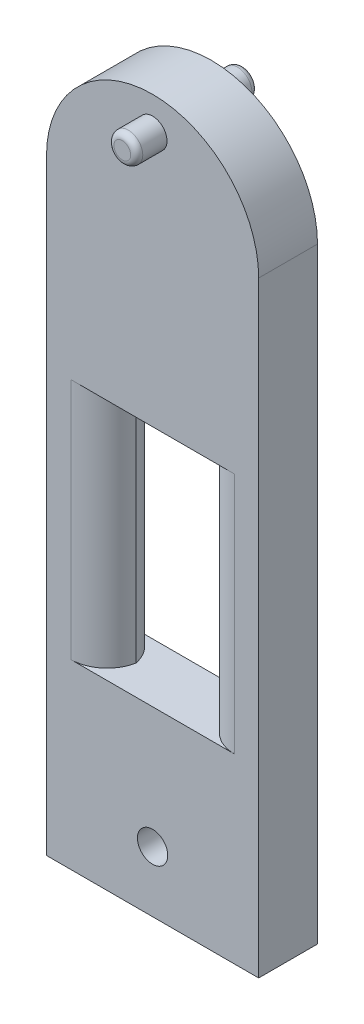
from build123d import *

# Parameters (mm, degrees)
SKETCH1_R           = 2.5
SKETCH1_W           = 15
SKETCH1_H           = 40
BOSS_EXTRUDE1_DEPTH = 9.7
BOSS_EXTRUDE2_START = -5
SKETCH2_R           = 2.38
BOSS_EXTRUDE2_DEPTH = 10
FILLET1_R           = 1
FILLET2_R           = 6


with BuildPart() as part:
    # Sketch1 → Boss-Extrude1 (new body)
    # profile 1 of 2: a face of its own
    with BuildSketch(Plane.XY):
        with BuildLine():
            ThreePointArc((-17.5, 50), (0, 67.5), (17.5, 50))
            Line((17.5, 50), (17.5, -50))
            Line((17.5, -50), (-17.5, -50))
            Line((-17.5, -50), (-17.5, 50))
        make_face()
        with Locations((0, -40)):
            Circle(SKETCH1_R, mode=Mode.SUBTRACT)
        Rectangle(SKETCH1_W, SKETCH1_H, mode=Mode.SUBTRACT)
    # profile 2 of 2: a face of its own
    with BuildSketch(Plane.XY):
        with BuildLine():
            ThreePointArc((-17.5, 50), (0, 67.5), (17.5, 50))
            Line((17.5, 50), (-17.5, 50))
        make_face()
    extrude(amount=BOSS_EXTRUDE1_DEPTH)

    # Sketch2 → Boss-Extrude2 (add, symmetric)
    with BuildSketch(Plane.XY.offset(9.7).offset(BOSS_EXTRUDE2_START)):
        with Locations((0, 62)):
            Circle(SKETCH2_R)
    extrude(amount=BOSS_EXTRUDE2_DEPTH, both=True)

    # Fillet1
    fillet1_edges = [part.edges().sort_by_distance(p)[0] for p in [
        (-2.38, 62, -5.3),
        (-2.38, 62, 14.7),
    ]]
    fillet(fillet1_edges, radius=FILLET1_R)

    # Fillet2
    # the kernel refuses this fillet: 6 mm, written as the material it takes off along each edge
    with BuildSketch(Plane(origin=(7.5, 20, 0), x_dir=(1, 0, 0), z_dir=(0, -1, 0)), Plane(origin=(7.5, 20, 9.7), x_dir=(0, 0, -1), z_dir=(0, -1, 0)), Plane(origin=(-7.5, -20, 0), x_dir=(-1, 0, 0), z_dir=(0, 1, 0)), Plane(origin=(-7.5, -20, 9.7), x_dir=(0, 0, -1), z_dir=(0, 1, 0))) as fillet2_piece_1:
        with BuildLine():
            CenterArc((FILLET2_R, FILLET2_R), FILLET2_R, 180, 90)
            Line((0, FILLET2_R), (0, 0))
            Line((0, 0), (FILLET2_R, 0))
        make_face()
    extrude(amount=40, mode=Mode.SUBTRACT)


solid = part.part
